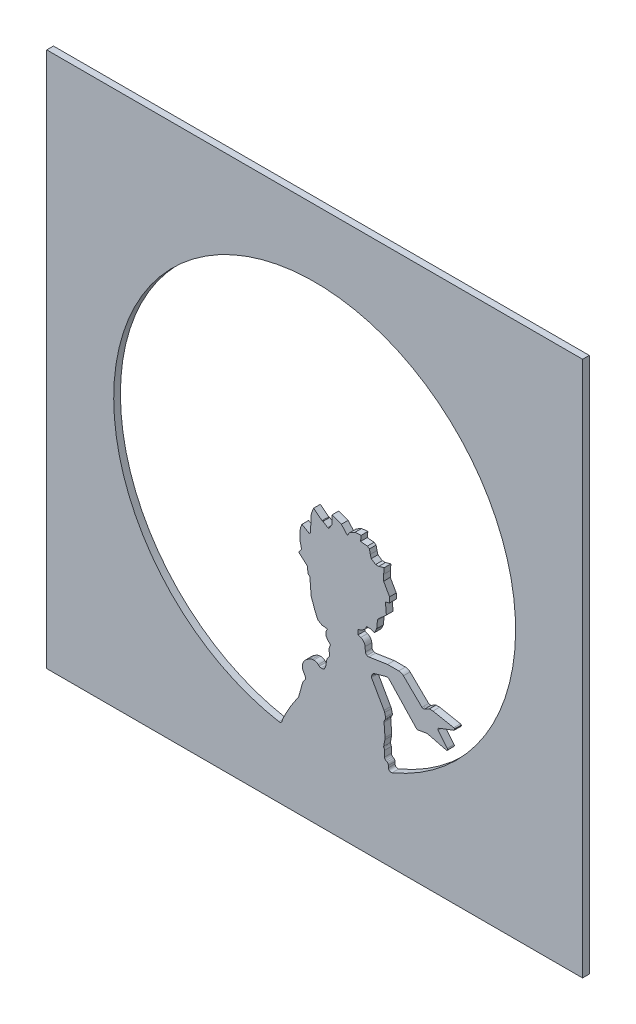
from build123d import *

# Parameters (mm, degrees)
ESQUISSE1_W        = 400
ESQUISSE1_H        = 400
ESQUISSE1_R        = 150
BOSS_EXTRU_1_DEPTH = 5
BOSS_EXTRU_2_START = -5
BOSS_EXTRU_2_DEPTH = 5
CONG_1_R           = 5
CONG_2_R           = 1
CONG_3_R           = 2
CONG_4_R           = 0.5
CONG_5_R           = 1
CONG_6_R           = 1


with BuildPart() as part:
    # Esquisse1 → Boss.-Extru.1 (new body)
    with BuildSketch(Plane.XY):
        Rectangle(ESQUISSE1_W, ESQUISSE1_H)
        Circle(ESQUISSE1_R, mode=Mode.SUBTRACT)
    extrude(amount=BOSS_EXTRU_1_DEPTH)

    # Esquisse2 → Boss.-Extru.2 (add)
    with BuildSketch(Plane.XY.offset(5).offset(BOSS_EXTRU_2_START)):
        with BuildLine():
            Line((55.031660762, -139.54037521), (55.031660762, -133.872999651))
            Line((55.031660762, -133.872999651), (52.207376278, -132.26557356))
            Line((52.207376278, -132.26557356), (52.207376278, -125.667114786))
            Line((52.207376278, -125.667114786), (51.285011073, -125.667114786))
            Line((51.285011073, -125.667114786), (52.570912333, -119.027663974))
            Line((52.570912333, -119.027663974), (51.746193676, -108.192001351))
            Line((51.746193676, -108.192001351), (53.211289646, -105.617794151))
            Line((53.211289646, -105.617794151), (52.089766511, -101.629576564))
            Line((52.089766511, -101.629576564), (42.110681869, -84.014322804))
            Line((42.110681869, -84.014322804), (43.732728635, -81.16434946))
            Line((43.732728635, -81.16434946), (54.696981132, -78.081101728))
            Line((54.696981132, -78.081101728), (76.427078331, -101.254121985))
            Line((76.427078331, -101.254121985), (82.858546362, -100.099755928))
            Line((82.858546362, -100.099755928), (83.936704217, -99.906240416))
            Line((83.936704217, -99.906240416), (98.67014109, -103.63343904))
            Line((98.67014109, -103.63343904), (99.612520482, -102.749739136))
            Line((99.612520482, -102.749739136), (91.303422654, -92.697596296))
            Line((91.303422654, -92.697596296), (104.813017077, -87.564250477))
            Line((104.813017077, -87.564250477), (104.355714497, -86.36075229))
            Line((104.355714497, -86.36075229), (88.316036707, -83.254254107))
            Line((88.316036707, -83.254254107), (85.495496033, -83.254254107))
            Line((85.495496033, -83.254254107), (81.954694786, -85.260126735))
            Line((81.954694786, -85.260126735), (80.388473602, -85.260126735))
            Line((80.388473602, -85.260126735), (64.804620267, -70.075910921))
            Line((64.804620267, -70.075910921), (54.425675053, -70.075910921))
            Line((54.425675053, -70.075910921), (39.720319432, -72.344056509))
            Line((39.720319432, -72.344056509), (37.979563937, -71.353315025))
            Line((37.979563937, -71.353315025), (37.401098088, -63.753073754))
            Line((37.401098088, -63.753073754), (32.493997578, -61.907634253))
            Line((32.493997578, -61.907634253), (32.493997578, -58.486166241))
            Line((32.493997578, -58.486166241), (35.501945475, -57.34321285))
            Line((35.501945475, -57.34321285), (37.979563937, -55.295214277))
            Line((37.979563937, -55.295214277), (38.678769262, -53.435998193))
            Line((38.678769262, -53.435998193), (42.232021918, -53.435998193))
            Line((42.232021918, -53.435998193), (44.703888428, -54.365606235))
            Line((44.703888428, -54.365606235), (46.277868047, -51.168967168))
            Line((46.277868047, -51.168967168), (46.957327378, -44.525364819))
            Line((46.957327378, -44.525364819), (53.525434246, -38.636717282))
            Line((53.525434246, -38.636717282), (52.850359319, -30.512312681))
            Line((52.850359319, -30.512312681), (55.918660799, -29.613599977))
            Line((55.918660799, -29.613599977), (55.918660799, -25.659264081))
            Line((55.918660799, -25.659264081), (51.471635523, -17.750592287))
            Line((51.471635523, -17.750592287), (51.471635523, -13.37386142))
            Line((51.471635523, -13.37386142), (51.941828176, -8.776422138))
            Line((51.941828176, -8.776422138), (47.868397823, -9.969539448))
            Line((47.868397823, -9.969539448), (45.490878238, -9.969539448))
            Line((45.490878238, -9.969539448), (42.232021918, -7.783373771))
            Line((42.232021918, -7.783373771), (41.523909113, -5.365800772))
            Line((41.523909113, -5.365800772), (40.868928924, -2.192978218))
            Line((40.868928924, -2.192978218), (39.314706446, -1.150346232))
            Line((39.314706446, -1.150346232), (34.270671774, -0.63447905))
            Line((34.270671774, -0.63447905), (34.69480664, 3.51261742))
            Line((34.69480664, 3.51261742), (30.071545052, 3.128460287))
            Line((30.071545052, 3.128460287), (26.104736333, 0.897934214))
            Line((26.104736333, 0.897934214), (24.406526569, -1.63353981))
            Line((24.406526569, -1.63353981), (19.964938801, 3.320538853))
            Line((19.964938801, 3.320538853), (13.072420597, 5.969812723))
            Line((13.072420597, 5.969812723), (13.072420597, -0.367802798))
            Line((13.072420597, -0.367802798), (10.630855105, -4.007376514))
            Line((10.630855105, -4.007376514), (9.744072236, -4.007376514))
            Line((9.744072236, -4.007376514), (6.205459941, -1.63353981))
            Line((6.205459941, -1.63353981), (5.587643384, -1.63353981))
            Line((5.587643384, -1.63353981), (-0.798803479, 3.320538853))
            Line((-0.798803479, 3.320538853), (-2.521505001, -1.161350218))
            Line((-2.521505001, -1.161350218), (-3.153295523, -13.783951582))
            Line((-3.153295523, -13.783951582), (-4.046620746, -14.584863851))
            Line((-4.046620746, -14.584863851), (-9.515073433, -11.470577796))
            Line((-9.515073433, -11.470577796), (-10.712110049, -14.584863851))
            Line((-10.712110049, -14.584863851), (-11.087676873, -22.08834822))
            Line((-11.087676873, -22.08834822), (-9.737121833, -27.636432029))
            Line((-9.737121833, -27.636432029), (-11.619419223, -30.06295633))
            Line((-11.619419223, -30.06295633), (-11.619419223, -30.876509863))
            Line((-11.619419223, -30.876509863), (-5.384119265, -36.446768251))
            Line((-5.384119265, -36.446768251), (-5.001437238, -41.052277213))
            Line((-5.001437238, -41.052277213), (-3.599958134, -42.304278045))
            Line((-3.599958134, -42.304278045), (-3.153295522, -47.679781759))
            Line((-3.153295522, -47.679781759), (-2.597755432, -54.365606235))
            Line((-2.597755432, -54.365606235), (0, -61.907634253))
            Line((0, -61.907634253), (2.394419952, -67.356689252))
            Line((2.394419952, -67.356689252), (5.587643384, -69.17523131))
            Line((5.587643384, -69.17523131), (9.744072236, -69.600320624))
            Line((9.744072236, -69.600320624), (8.306139812, -71.743806462))
            Line((8.306139812, -71.743806462), (8.306139812, -74.170893278))
            Line((8.306139812, -74.170893278), (9.744072236, -76.72813883))
            Line((9.744072236, -76.72813883), (11.851637851, -78.610916743))
            Line((11.851637851, -78.610916743), (10.87017616, -81.16434946))
            Line((10.87017616, -81.16434946), (10.87017616, -83.875983824))
            Line((10.87017616, -83.875983824), (11.360907006, -85.891907485))
            Line((11.360907006, -85.891907485), (9.134937588, -89.210098132))
            Line((9.134937588, -89.210098132), (8.166567806, -94.862546856))
            Line((8.166567806, -94.862546856), (6.854611653, -97.166243442))
            Line((6.854611653, -97.166243442), (3.991031668, -97.166243442))
            Line((3.991031668, -97.166243442), (1.299470798, -94.761757754))
            Line((1.299470798, -94.761757754), (-1.064638168, -94.761757754))
            Line((-1.064638168, -94.761757754), (-3.153295522, -95.192928791))
            Line((-3.153295522, -95.192928791), (-6.57083935, -97.486227549))
            Line((-6.57083935, -97.486227549), (-8.607123486, -100.111260641))
            Line((-8.607123486, -100.111260641), (-9.163158525, -102.134701428))
            Line((-9.163158525, -102.134701428), (-9.163158525, -104.676836685))
            Line((-9.163158525, -104.676836685), (-6.298057946, -109.772184412))
            Line((-6.298057946, -109.772184412), (-8.885141006, -113.107268413))
            Line((-8.885141006, -113.107268413), (-10.915631482, -120.496330184))
            Line((-10.915631482, -120.496330184), (-11.960074473, -124.297113229))
            Line((-11.960074473, -124.297113229), (-17.313340763, -132.277078273))
            Line((-17.313340763, -132.277078273), (-20.933691144, -138.634141953))
            Line((-20.933691144, -138.634141953), (-24.020768288, -144.903772947))
            Line((-24.020768288, -144.903772947), (-24.851544548, -147.927011508))
            ThreePointArc((-24.851544548, -147.927011508), (15.661857194, -149.180113384), (55.031660762, -139.54037521))
        make_face()
    extrude(amount=BOSS_EXTRU_2_DEPTH)

    # Congé1
    # the kernel refuses this fillet: 5 mm, written as the material it adds along each edge
    with BuildSketch(Plane(origin=(-11.960074473, -124.297113229, 0), x_dir=(0.2649743110271308, 0.9642554715923044, 0), z_dir=(0, 0, 1))) as cong_1_piece_1:
        with BuildLine():
            CenterArc((CONG_1_R * 0.162768939476, CONG_1_R), CONG_1_R, 251.510203454, 18.489796546)
            Line((-CONG_1_R * 0.154366830749, CONG_1_R * 0.0516198529892), (0, 0))
            Line((0, 0), (CONG_1_R * 0.162768939476, 0))
        make_face()
    extrude(amount=5)
    # the kernel refuses this fillet: 5 mm, written as the material it takes off along each edge
    with BuildSketch(Plane(origin=(37.401098088, -63.753073754, -7.969127322), x_dir=(-0.9359978518888589, 0.3520057119699081, 0), z_dir=(0, 0, 1))) as cong_1_2_piece_1:
        with BuildLine():
            CenterArc((CONG_1_R * 0.637530185741, CONG_1_R), CONG_1_R, 204.962519321, 65.037480679)
            Line((-CONG_1_R * 0.269053867849, CONG_1_R * 0.577974700075), (0, 0))
            Line((0, 0), (CONG_1_R * 0.637530185741, 0))
        make_face()
    extrude(amount=20.938254644, mode=Mode.SUBTRACT)
    with BuildSketch(Plane(origin=(64.804620267, -70.075910921, -5.082821052), x_dir=(-1, 0, 0), z_dir=(0, 0, 1))) as cong_1_2_piece_2:
        with BuildLine():
            CenterArc((CONG_1_R * 0.406625684128, CONG_1_R), CONG_1_R, 225.744156406, 44.255843594)
            Line((-CONG_1_R * 0.29123782769, CONG_1_R * 0.283769227921), (0, 0))
            Line((0, 0), (CONG_1_R * 0.406625684128, 0))
        make_face()
    extrude(amount=15.165642103, mode=Mode.SUBTRACT)
    with BuildSketch(Plane(origin=(52.089766511, -101.629576564, -1.515454703), x_dir=(-0.4929044237119181, 0.87008346098821, 0), z_dir=(0, 0, 1))) as cong_1_2_piece_3:
        with BuildLine():
            CenterArc((CONG_1_R * 0.121236376233, CONG_1_R), CONG_1_R, 256.174806594, 13.825193406)
            Line((-CONG_1_R * 0.117724073668, CONG_1_R * 0.0289706990091), (0, 0))
            Line((0, 0), (CONG_1_R * 0.121236376233, 0))
        make_face()
    extrude(amount=8.030909406, mode=Mode.SUBTRACT)
    with BuildSketch(Plane(origin=(52.570912333, -119.027663974, -1.680467822), x_dir=(-0.07589200892817809, 0.9971160428861053, 0), z_dir=(0, 0, 1))) as cong_1_2_piece_4:
        with BuildLine():
            CenterArc((CONG_1_R * 0.134437425768, CONG_1_R), CONG_1_R, 254.686421566, 15.313578434)
            Line((-CONG_1_R * 0.129664205678, CONG_1_R * 0.0355051434728), (0, 0))
            Line((0, 0), (CONG_1_R * 0.134437425768, 0))
        make_face()
    extrude(amount=8.360935644, mode=Mode.SUBTRACT)
    with BuildSketch(Plane(origin=(-24.020768288, -144.903772947, -1.187051783), x_dir=(-0.26497431102724306, -0.9642554715922735, 0), z_dir=(0, 0, 1))) as cong_1_2_piece_5:
        with BuildLine():
            CenterArc((CONG_1_R * 0.0949641426717, CONG_1_R), CONG_1_R, 259.150447212, 10.849552788)
            Line((-CONG_1_R * 0.0932666419941, CONG_1_R * 0.0178751750902), (0, 0))
            Line((0, 0), (CONG_1_R * 0.0949641426717, 0))
        make_face()
    extrude(amount=7.374103567, mode=Mode.SUBTRACT)
    with BuildSketch(Plane(origin=(-20.933691144, -138.634141953, -0.376073854), x_dir=(-0.441740412859278, -0.897142913724962, 0), z_dir=(0, 0, 1))) as cong_1_2_piece_6:
        with BuildLine():
            CenterArc((CONG_1_R * 0.0300859083161, CONG_1_R), CONG_1_R, 266.553448506, 3.446551494)
            Line((-CONG_1_R * 0.0300314923367, CONG_1_R * 0.00180868660424), (0, 0))
            Line((0, 0), (CONG_1_R * 0.030085908316, 0))
        make_face()
    extrude(amount=5.752147708, mode=Mode.SUBTRACT)
    with BuildSketch(Plane(origin=(-17.313340763, -132.277078273, -0.457665201), x_dir=(-0.4948753428792307, -0.8689639779704126, 0), z_dir=(0, 0, 1))) as cong_1_2_piece_7:
        with BuildLine():
            CenterArc((CONG_1_R * 0.0366132161064, CONG_1_R), CONG_1_R, 265.806307736, 4.193692264)
            Line((-CONG_1_R * 0.0365151854663, CONG_1_R * 0.0026774659703), (0, 0))
            Line((0, 0), (CONG_1_R * 0.0366132161065, 0))
        make_face()
    extrude(amount=5.915330403, mode=Mode.SUBTRACT)
    with BuildSketch(Plane(origin=(-8.885141006, -113.107268413, -2.479140256), x_dir=(-0.2649743110271317, -0.9642554715923042, 0), z_dir=(0, 0, 1)), Plane(origin=(-8.607123486, -100.111260641, -2.479140256), x_dir=(-0.2649743110271697, -0.9642554715922937, 0), z_dir=(0, 0, 1))) as cong_1_2_piece_8:
        with BuildLine():
            CenterArc((CONG_1_R * 0.198331220473, CONG_1_R), CONG_1_R, 247.564067044, 22.435932956)
            Line((-CONG_1_R * 0.183318908456, CONG_1_R * 0.0756931358641), (0, 0))
            Line((0, 0), (CONG_1_R * 0.198331220473, 0))
        make_face()
    extrude(amount=9.958280512, mode=Mode.SUBTRACT)
    with BuildSketch(Plane(origin=(1.299470798, -94.761757754, -4.770257487), x_dir=(-1, 0, 0), z_dir=(0, 0, 1))) as cong_1_2_piece_9:
        with BuildLine():
            CenterArc((CONG_1_R * 0.381620598976, CONG_1_R), CONG_1_R, 228.224230837, 41.775769163)
            Line((-CONG_1_R * 0.284596543995, CONG_1_R * 0.254242185148), (0, 0))
            Line((0, 0), (CONG_1_R * 0.381620598976, 0))
        make_face()
    extrude(amount=14.540514974, mode=Mode.SUBTRACT)
    with BuildSketch(Plane(origin=(-1.064638168, -94.761757754, -1.276755527), x_dir=(-0.9793500938101285, -0.20217169375086294, 0), z_dir=(0, 0, 1))) as cong_1_2_piece_10:
        with BuildLine():
            CenterArc((CONG_1_R * 0.10214044215, CONG_1_R), CONG_1_R, 258.336017421, 11.663982579)
            Line((-CONG_1_R * 0.100031251601, CONG_1_R * 0.0206499061899), (0, 0))
            Line((0, 0), (CONG_1_R * 0.10214044215, 0))
        make_face()
    extrude(amount=7.553511054, mode=Mode.SUBTRACT)
    with BuildSketch(Plane(origin=(-3.153295522, -95.192928791, -2.452299989), x_dir=(-0.8303715328062417, -0.557210119708008, 0), z_dir=(0, 0, 1))) as cong_1_2_piece_11:
        with BuildLine():
            CenterArc((CONG_1_R * 0.196183999094, CONG_1_R), CONG_1_R, 247.800904917, 22.199095083)
            Line((-CONG_1_R * 0.181642164684, CONG_1_R * 0.0741234477725), (0, 0))
            Line((0, 0), (CONG_1_R * 0.196183999094, 0))
        make_face()
    extrude(amount=9.904599977, mode=Mode.SUBTRACT)
    with BuildSketch(Plane(origin=(-6.57083935, -97.486227549, -2.01734551), x_dir=(-0.6129257995554592, -0.7901404712070513, 0), z_dir=(0, 0, 1))) as cong_1_2_piece_12:
        with BuildLine():
            CenterArc((CONG_1_R * 0.161387640839, CONG_1_R), CONG_1_R, 251.664436979, 18.335563021)
            Line((-CONG_1_R * 0.153194055227, CONG_1_R * 0.0507695977792), (0, 0))
            Line((0, 0), (CONG_1_R * 0.161387640839, 0))
        make_face()
    extrude(amount=9.034691021, mode=Mode.SUBTRACT)
    with BuildSketch(Plane(origin=(-9.163158525, -102.134701428, -1.686226123), x_dir=(0, -1, 0), z_dir=(0, 0, 1))) as cong_1_2_piece_13:
        with BuildLine():
            CenterArc((CONG_1_R * 0.134898089815, CONG_1_R), CONG_1_R, 254.634573639, 15.365426361)
            Line((-CONG_1_R * 0.130076221212, CONG_1_R * 0.0357445284077), (0, 0))
            Line((0, 0), (CONG_1_R * 0.134898089815, 0))
        make_face()
    extrude(amount=8.372452245, mode=Mode.SUBTRACT)
    with BuildSketch(Plane(origin=(-9.163158525, -104.676836685, -3.273360372), x_dir=(0.49012705738646695, -0.871651001042093, 0), z_dir=(0, 0, 1))) as cong_1_2_piece_14:
        with BuildLine():
            CenterArc((CONG_1_R * 0.261868829773, CONG_1_R), CONG_1_R, 240.65106697, 29.34893303)
            Line((-CONG_1_R * 0.228258227613, CONG_1_R * 0.128348998958), (0, 0))
            Line((0, 0), (CONG_1_R * 0.261868829773, 0))
        make_face()
    extrude(amount=11.546720744, mode=Mode.SUBTRACT)

    # Congé2
    # the kernel refuses this fillet: 1 mm, written as the material it adds along each edge
    with BuildSketch(Plane(origin=(91.303422654, -92.697596296, 0), x_dir=(0.6371163013568706, -0.7707676813056846, 0), z_dir=(0, 0, 1))) as cong_2_piece_1:
        with BuildLine():
            CenterArc((CONG_2_R * 1.39605011386, CONG_2_R), CONG_2_R, 161.22855508, 108.77144492)
            Line((CONG_2_R * 0.449240360487, CONG_2_R * 1.32179386401), (0, 0))
            Line((0, 0), (CONG_2_R * 1.39605011386, 0))
        make_face()
    extrude(amount=5)
    with BuildSketch(Plane(origin=(51.285011073, -125.667114786, 0), x_dir=(1, 0, 0), z_dir=(0, 0, 1))) as cong_2_piece_2:
        with BuildLine():
            CenterArc((1.204396148, 0.959405309), CONG_2_R, 169.038898301, 84.579646499)
            Line((0.22263965, 1.149547831), (0, 0))
            Line((0, 0), (0.922365205, 0))
        make_face()
    extrude(amount=5)
    # the kernel refuses this fillet: 1 mm, written as the material it takes off along each edge
    with BuildSketch(Plane(origin=(98.67014109, -103.63343904, -1.367464576), x_dir=(-0.9694599642091309, 0.2452496234362664, 0), z_dir=(0, 0, 1))) as cong_2_2_piece_1:
        with BuildLine():
            CenterArc((CONG_2_R * 0.546985830472, -CONG_2_R), CONG_2_R, 90, 57.356068912)
            Line((-CONG_2_R * 0.295053220683, -CONG_2_R * 0.460583429686), (0, 0))
            Line((0, 0), (CONG_2_R * 0.546985830472, 0))
        make_face()
    extrude(amount=7.734929152, mode=Mode.SUBTRACT)
    with BuildSketch(Plane(origin=(99.612520482, -102.749739136, -2.348380633), x_dir=(-0.7294525291645552, -0.6840314376513946, 0), z_dir=(0, 0, 1))) as cong_2_2_piece_2:
        with BuildLine():
            CenterArc((CONG_2_R * 0.939352253321, -CONG_2_R), CONG_2_R, 90, 86.417641163)
            Line((-CONG_2_R * 0.0586937607742, -CONG_2_R * 0.937516772258), (0, 0))
            Line((0, 0), (CONG_2_R * 0.939352253321, 0))
        make_face()
    extrude(amount=9.696761267, mode=Mode.SUBTRACT)
    with BuildSketch(Plane(origin=(104.813017077, -87.564250477, -2.5), x_dir=(-0.9347904746824026, -0.35519961774057196, 0), z_dir=(0, 0, 1))) as cong_2_2_piece_3:
        with BuildLine():
            CenterArc((CONG_2_R, -CONG_2_R), CONG_2_R, 90, 90)
            Line((0, -CONG_2_R), (0, 0))
            Line((0, 0), (CONG_2_R, 0))
        make_face()
    extrude(amount=10, mode=Mode.SUBTRACT)
    with BuildSketch(Plane(origin=(104.355714497, -86.36075229, -1.392431555), x_dir=(0.35519961773964914, -0.9347904746827531, 0), z_dir=(0, 0, 1))) as cong_2_2_piece_4:
        with BuildLine():
            CenterArc((CONG_2_R * 0.556972621957, -CONG_2_R), CONG_2_R, 90, 58.233219317)
            Line((-CONG_2_R * 0.293225450002, -CONG_2_R * 0.473537049322), (0, 0))
            Line((0, 0), (CONG_2_R * 0.556972621957, 0))
        make_face()
    extrude(amount=7.78486311, mode=Mode.SUBTRACT)

    # Congé3
    cong_3_edges = [part.edges().sort_by_distance(p)[0] for p in [
        (52.207376278, -132.26557356, 2.5),
        (55.031660762, -133.872999651, 2.5),
        (55.031660762, -139.54037521, 2.5),
        (-24.851544548, -147.927011508, 2.5),
        (-6.298057946, -109.772184412, 2.5),
        (3.991031668, -97.166243442, 2.5),
        (6.854611653, -97.166243442, 2.5),
        (8.166567806, -94.862546856, 2.5),
        (9.134937588, -89.210098132, 2.5),
        (11.360907006, -85.891907485, 2.5),
        (10.87017616, -83.875983824, 2.5),
        (10.87017616, -81.16434946, 2.5),
        (46.957327378, -44.525364819, 2.5),
        (37.979563937, -71.353315025, 2.5),
        (39.720319432, -72.344056509, 2.5),
        (83.936704217, -99.906240416, 2.5),
        (76.427078331, -101.254121985, 2.5),
        (54.696981132, -78.081101728, 2.5),
        (53.211289646, -105.617794151, 2.5),
        (51.746193676, -108.192001351, 2.5),
        (52.207376278, -125.667114786, 2.5),
    ]]
    fillet(cong_3_edges, radius=CONG_3_R)

    # Congé4
    cong_4_edges = [part.edges().sort_by_distance(p)[0] for p in [
        (5.587643384, -1.63353981, 2.5),
        (6.205459941, -1.63353981, 2.5),
    ]]
    fillet(cong_4_edges, radius=CONG_4_R)

    # Congé5
    cong_5_edges = [part.edges().sort_by_distance(p)[0] for p in [
        (80.388473602, -85.260126735, 2.5),
        (81.954694786, -85.260126735, 2.5),
        (85.495496033, -83.254254107, 2.5),
    ]]
    fillet(cong_5_edges, radius=CONG_5_R)

    # Congé6
    cong_6_edges = [part.edges().sort_by_distance(p)[0] for p in [
        (43.732728635, -81.16434946, 2.5),
        (42.110681869, -84.014322804, 2.5),
    ]]
    fillet(cong_6_edges, radius=CONG_6_R)


solid = part.part
